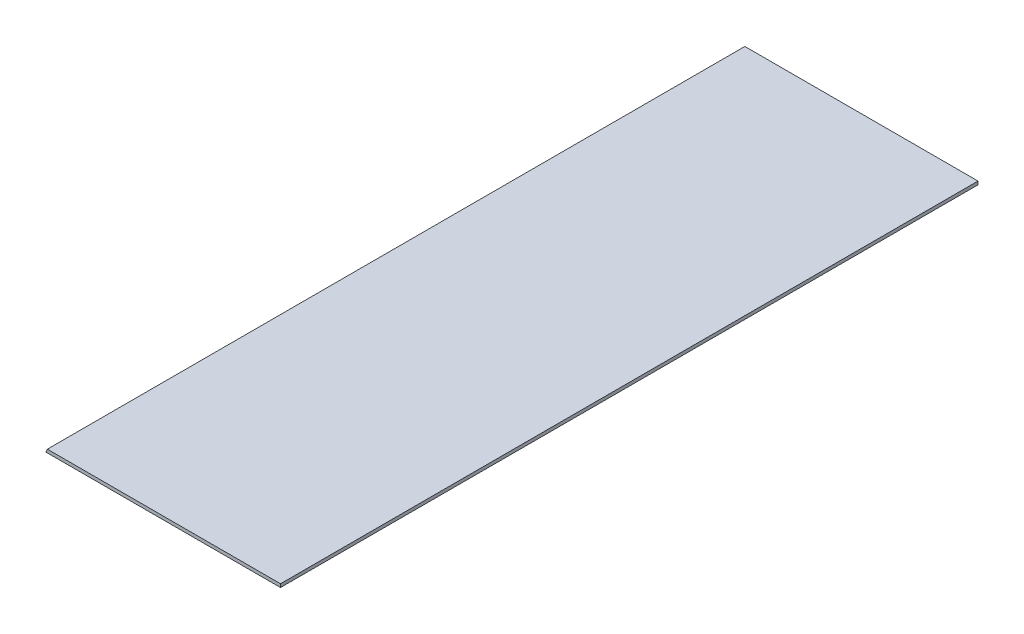
from build123d import *

# Parameters (mm, degrees)
BOSS_EXTRUDE1_DEPTH = 501.65


with BuildPart() as part:
    # Sketch1 → Boss-Extrude1 (new body)
    with BuildSketch(Plane.XY):
        Polygon((0, 0), (0.978455277, 2.3622), (168.656, 2.3622), (168.656, 0), align=None)
    extrude(amount=BOSS_EXTRUDE1_DEPTH)


solid = part.part
